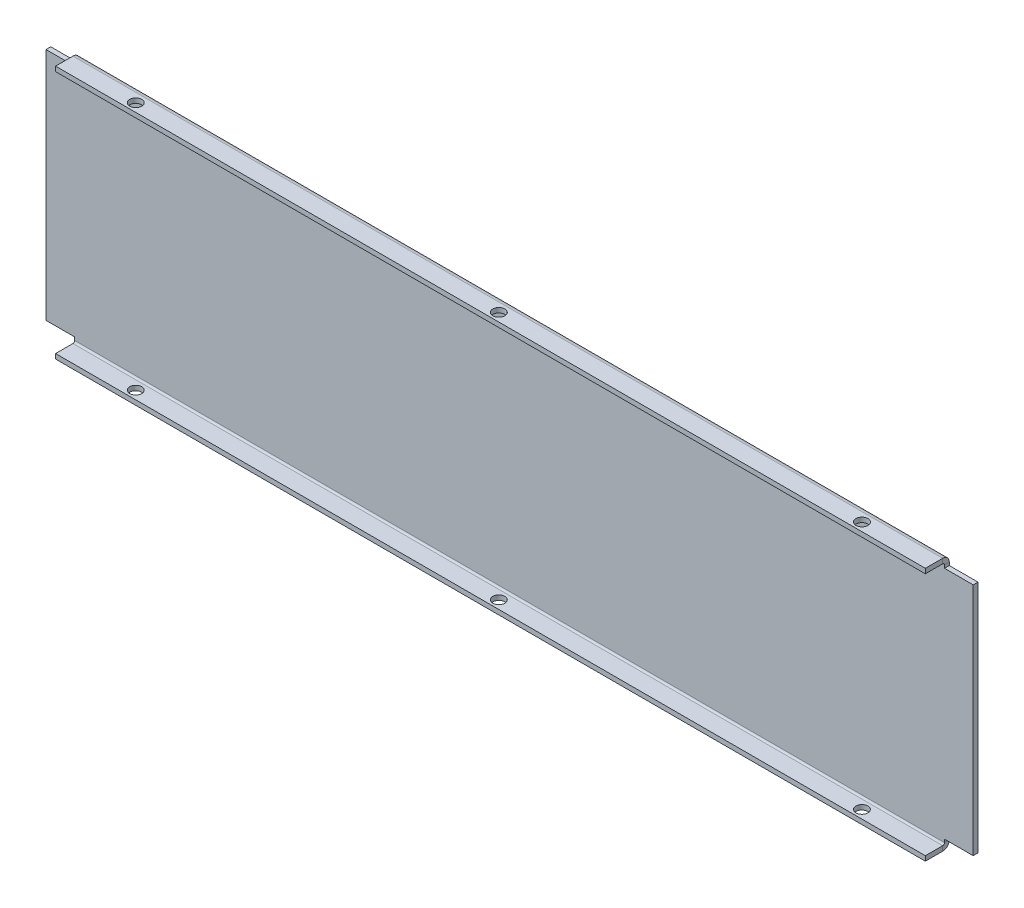
from build123d import *

# Parameters (mm, degrees)
SKETCH1_W                    = 387.4
SKETCH1_H                    = 106
BASE_FLANGE1_DEPTH           = 2
EDGE_FLANGE1_STRIP_W         = 9.4732
EDGE_FLANGE1_STRIP_H         = 2
EDGE_FLANGE1_STRIP_CUT_DEPTH = 387.4
EDGE_FLANGE1_DEPTH           = 387.4
EDGE_FLANGE2_STRIP_W         = 9.4732
EDGE_FLANGE2_STRIP_H         = 2
EDGE_FLANGE2_STRIP_CUT_DEPTH = 387.4
EDGE_FLANGE2_DEPTH           = 387.4
SKETCH14_W                   = 73.905952632
SKETCH14_H                   = 44.03163087
CUT_EXTRUDE1_DEPTH           = 4
MIRROR2_COPY_1_SKETCH_W      = 73.905952632
MIRROR2_COPY_1_SKETCH_H      = 44.03163087
MIRROR2_COPY_1_DEPTH         = 4
CUT_EXTRUDE2_DEPTH           = 221.95178207
CUT_EXTRUDE2_DEPTH_BACK      = 221.95178207
SKETCH15_R                   = 2.5


# Sheet-metal steps are written as plain solids
with BuildPart() as part:
    # Sketch1 → Base-Flange1 (new body)
    with BuildSketch(Plane.XY):
        Rectangle(SKETCH1_W, SKETCH1_H)
    extrude(amount=-BASE_FLANGE1_DEPTH)

    # Edge-Flange1 strip (across the edge) → Edge-Flange1 strip cut (cut)
    with BuildSketch(Plane(origin=(193.7, 53, 0), x_dir=(0, -1, 0), z_dir=(-1, 0, 0))):
        with Locations((-2, -1)):
            Rectangle(EDGE_FLANGE1_STRIP_W, EDGE_FLANGE1_STRIP_H)
    extrude(amount=EDGE_FLANGE1_STRIP_CUT_DEPTH, mode=Mode.SUBTRACT)

    # Edge-Flange1 section (across the edge) → Edge-Flange1 (add)
    with BuildSketch(Plane(origin=(193.7, 53, 0), x_dir=(0, -1, 0), z_dir=(-1, 0, 0))):
        with BuildLine():
            Line((0, 0.7366), (0, 8))
            Line((0, 8), (2, 8))
            Line((2, 8), (2, 0.7366))
            ThreePointArc((2, 0.7366), (2.215745145, 0.215745145), (2.7366, 0))
            Line((2.7366, 0), (2.7366, -2))
            ThreePointArc((2.7366, -2), (0.801531583, -1.198468417), (0, 0.7366))
        make_face()
    extrude(amount=EDGE_FLANGE1_DEPTH)

    # Edge-Flange2 strip (across the edge) → Edge-Flange2 strip cut (cut)
    with BuildSketch(Plane(origin=(-193.7, -53, 0), x_dir=(0, 1, 0), z_dir=(1, 0, 0))):
        with Locations((-2, -1)):
            Rectangle(EDGE_FLANGE2_STRIP_W, EDGE_FLANGE2_STRIP_H)
    extrude(amount=EDGE_FLANGE2_STRIP_CUT_DEPTH, mode=Mode.SUBTRACT)

    # Edge-Flange2 section (across the edge) → Edge-Flange2 (add)
    with BuildSketch(Plane(origin=(-193.7, -53, 0), x_dir=(0, 1, 0), z_dir=(1, 0, 0))):
        with BuildLine():
            Line((0, 0.7366), (0, 8))
            Line((0, 8), (2, 8))
            Line((2, 8), (2, 0.7366))
            ThreePointArc((2, 0.7366), (2.215745145, 0.215745145), (2.7366, 0))
            Line((2.7366, 0), (2.7366, -2))
            ThreePointArc((2.7366, -2), (0.801531583, -1.198468417), (0, 0.7366))
        make_face()
    extrude(amount=EDGE_FLANGE2_DEPTH)

    # Sketch14 → Cut-Extrude1 (cut)
    with BuildSketch(Plane(origin=(0, 53, 0), x_dir=(1, 0, 0), z_dir=(0, 1, 0))):
        with Locations((-218.652976316, 2.389975087)):
            Rectangle(SKETCH14_W, SKETCH14_H)
    cut_extrude1 = extrude(amount=-CUT_EXTRUDE1_DEPTH, mode=Mode.SUBTRACT)

    # Mirror1: Cut-Extrude1 across plane
    add(cut_extrude1.mirror(Plane.ZX), mode=Mode.SUBTRACT)

    # Mirror2: Cut-Extrude1 across plane
    add(cut_extrude1.mirror(Plane(origin=(0, 0, 0), x_dir=(0, 0, 1), z_dir=(1, 0, 0))), mode=Mode.SUBTRACT)

    # Mirror2 copy 1 sketch → Mirror2 copy 1 (cut)
    with BuildSketch(Plane(origin=(0, -53, 0), x_dir=(-1, 0, 0), z_dir=(0, -1, 0))):
        with Locations((-218.652976316, 2.389975087)):
            Rectangle(MIRROR2_COPY_1_SKETCH_W, MIRROR2_COPY_1_SKETCH_H)
    extrude(amount=-MIRROR2_COPY_1_DEPTH, mode=Mode.SUBTRACT)

    # Sketch15 → Cut-Extrude2 (cut, two sides: drawn at the far end of the back side and taken through both)
    with BuildSketch(Plane(origin=(0, 53, 0), x_dir=(1, 0, 0), z_dir=(0, 1, 0)).offset(-CUT_EXTRUDE2_DEPTH_BACK)):
        with Locations(Location((151.7, -4.5, 0), (0, 0, 270))):
            Circle(SKETCH15_R)
        with Locations(Location((0, -4.5, 0), (0, 0, 270))):
            Circle(SKETCH15_R)
        with Locations(Location((-151.7, -4.5, 0), (0, 0, 270))):
            Circle(SKETCH15_R)
    extrude(amount=CUT_EXTRUDE2_DEPTH + CUT_EXTRUDE2_DEPTH_BACK, mode=Mode.SUBTRACT)


solid = part.part
